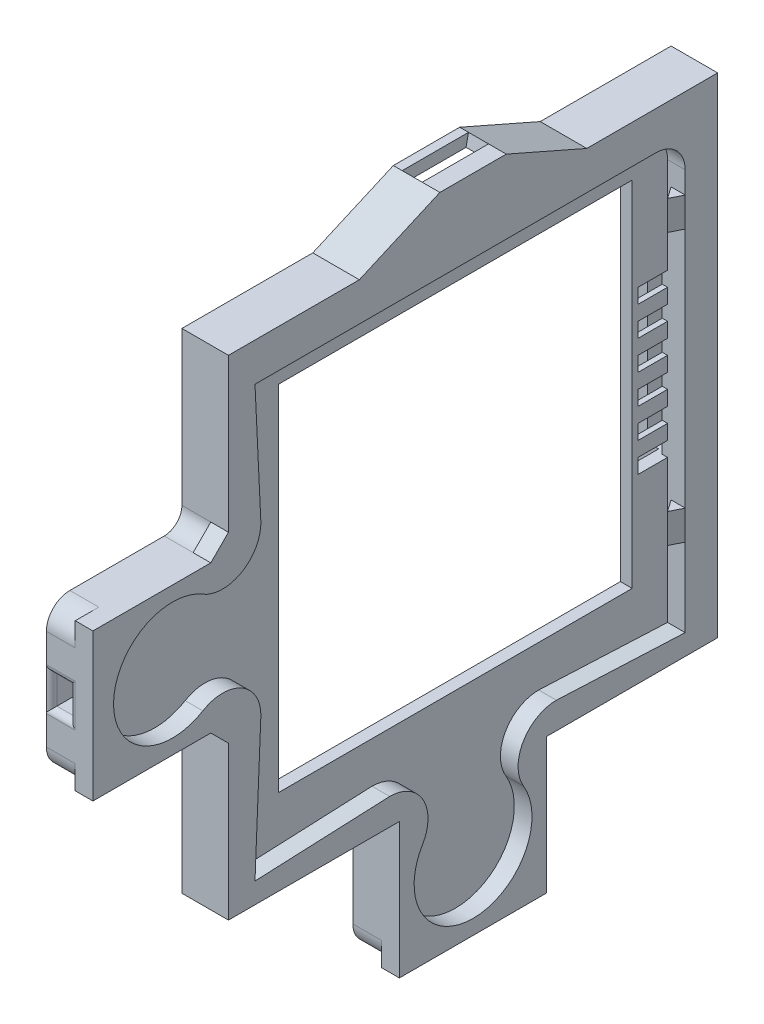
from build123d import *

# Parameters (mm, degrees)
SKETCH1_W                 = 190
SKETCH1_H                 = 190
BOSS_EXTRUDE1_DEPTH       = 10
CUT_EXTRUDE1_DEPTH        = 5
SKETCH3_W                 = 60
SKETCH3_H                 = 60
CUT_EXTRUDE2_DEPTH        = 139.021737418
CUT_EXTRUDE3_DEPTH        = 3
SKETCH8_W                 = 40.8
SKETCH8_H                 = 8.6
CUT_EXTRUDE4_DEPTH        = 2.6
CUT_EXTRUDE5_DEPTH        = 7
FILLET1_R                 = 3
SKETCH10_W                = 3.1
SKETCH10_H                = 5.2
CUT_EXTRUDE6_DEPTH        = 12.5
FILLET2_R                 = 1
SKETCH11_W                = 3.1
SKETCH11_H                = 5.2
CUT_EXTRUDE7_DEPTH        = 13.5
FILLET3_R                 = 1
FILLET4_R                 = 4
SKETCH12_W                = 4
SKETCH12_H                = 5.2
CUT_EXTRUDE8_DEPTH        = 2
SKETCH13_W                = 3
SKETCH13_H                = 5.2
CUT_EXTRUDE9_DEPTH        = 6
SKETCH14_W                = 3
SKETCH14_H                = 10
BOSS_EXTRUDE2_DEPTH       = 7
SKETCH16_W                = 3.2
SKETCH16_H                = 5
CUT_EXTRUDE10_DEPTH       = 6
FILLET5_R                 = 1
SKETCH17_W                = 131.159114754
SKETCH17_H                = 131.95401848
CUT_EXTRUDE11_DEPTH       = 2.1
CUT_EXTRUDE12_DEPTH       = 2
SKETCH19_W                = 5
SKETCH19_H                = 2.5
CUT_EXTRUDE13_DEPTH       = 139.108652879
SKETCH20_W                = 10.5
SKETCH20_H                = 27.5
CUT_EXTRUDE14_DEPTH       = 4
CHAMFER1_SIZE             = 0.9
BOSS_EXTRUDE10_DEPTH      = 1
BOSS_EXTRUDE10_DEPTH_BACK = 1
SKETCH33_W                = 5
SKETCH33_H                = 37.5
SKETCH34_W                = 3
SKETCH34_H                = 34
CUT_EXTRUDE19_DEPTH       = 3
CHAMFER2_SIZE             = 1
SKETCH24_R                = 5
SKETCH24_R_2              = 0.75
BOSS_EXTRUDE5_DEPTH       = 5
SKETCH25_R                = 0.75
CUT_EXTRUDE16_DEPTH       = 3.5
BOSS_EXTRUDE6_DEPTH       = 8
CUT_EXTRUDE17_REACH       = 140.163
SKETCH28_W                = 16
SKETCH28_H                = 5
SKETCH30_W                = 4
SKETCH30_H                = 10.417424305
SKETCH30_W_2              = 10.417424305
SKETCH30_H_2              = 4
BOSS_EXTRUDE8_DEPTH       = 2.5
FILLET10_START            = 2
FILLET10_DEPTH            = 5
FILLET10_START_2          = 4.5
FILLET10_2_DEPTH          = 3.5
FILLET10_START_3          = 2.1
FILLET10_3_DEPTH          = 2.4
FILLET10_4_DEPTH          = 0.4719
SKETCH31_R                = 0.75
CUT_EXTRUDE18_DEPTH       = 5
FILLET11_R                = 3
BOSS_EXTRUDE9_DEPTH       = 1.5
FILLET12_R                = 1.5
SKETCH35_R                = 2.5
CUT_EXTRUDE20_DEPTH       = 1.6
SKETCH36_W                = 3.2
SKETCH36_H                = 7
SKETCH36_W_2              = 7
SKETCH36_H_2              = 3.2
CUT_EXTRUDE21_DEPTH       = 139.113757461
BOSS_EXTRUDE12_START      = 8.7
BOSS_EXTRUDE12_DEPTH      = 5
BOSS_EXTRUDE13_START      = 54.7
BOSS_EXTRUDE13_DEPTH      = 5
CUT_EXTRUDE22_DEPTH       = 139.108652879
CUT_EXTRUDE22_DEPTH_BACK  = 139.108652879
SKETCH44_W                = 210.749266663
SKETCH44_H                = 205.670046908


with BuildPart() as part:
    # Sketch1 → Boss-Extrude1 (new body)
    with BuildSketch(Plane(origin=(0, 0, 0), x_dir=(0, 0, -1), z_dir=(1, 0, 0))):
        with Locations((-5, 0)):
            Rectangle(SKETCH1_W, SKETCH1_H)
    extrude(amount=BOSS_EXTRUDE1_DEPTH)

    # Sketch2 → Cut-Extrude1 (cut)
    with BuildSketch(Plane.ZY):
        Polygon((36.5, -36.5), (36.5, 36.5), (25.709845909, 36.5), (5.209845909, 45.5), (-5.209845909, 45.5), (-25.709845909, 36.5), (-36.5, 36.5), (-36.5, -36.5), align=None)
    extrude(amount=-CUT_EXTRUDE1_DEPTH, mode=Mode.SUBTRACT)

    # Sketch3 → Cut-Extrude2 (cut, through all)
    with BuildSketch(Plane.ZY.offset(-5)):
        Rectangle(SKETCH3_W, SKETCH3_H)
    extrude(amount=-CUT_EXTRUDE2_DEPTH, mode=Mode.SUBTRACT)

    # Sketch4 → Cut-Extrude3 (cut)
    with BuildSketch(Plane(origin=(10, 0, 0), x_dir=(0, 0, -1), z_dir=(1, 0, 0))):
        with BuildLine():
            Line((36, 30), (36, -37))
            Line((36, -37), (36, -38))
            Line((36, -38), (14.142135624, -37))
            ThreePointArc((14.142135624, -37), (8.484611805, -40.299621235), (8.570991287, -46.848484848))
            ThreePointArc((8.570991287, -46.848484848), (0, -62), (-8.570991287, -46.848484848))
            ThreePointArc((-8.570991287, -46.848484848), (-8.484611805, -40.299621235), (-14.142135624, -37))
            Line((-14.142135624, -37), (-37, -38))
            Line((-37, -38), (-36, -14.142135624))
            ThreePointArc((-36, -14.142135624), (-39.299621235, -8.484611805), (-45.848484848, -8.570991287))
            ThreePointArc((-45.848484848, -8.570991287), (-61, 0), (-45.848484848, 8.570991287))
            ThreePointArc((-45.848484848, 8.570991287), (-39.299621235, 8.484611805), (-36, 14.142135624))
            Line((-36, 14.142135624), (-37, 35))
            Line((-37, 35), (-36, 35))
            Line((-36, 35), (31, 35))
            ThreePointArc((31, 35), (34.535533906, 33.535533906), (36, 30))
        make_face()
    extrude(amount=-CUT_EXTRUDE3_DEPTH, mode=Mode.SUBTRACT)

    # Sketch8 → Cut-Extrude4 (cut)
    with BuildSketch(Plane.ZY):
        with Locations((0, 90.7)):
            Rectangle(SKETCH8_W, SKETCH8_H)
    extrude(amount=-CUT_EXTRUDE4_DEPTH, mode=Mode.SUBTRACT)

    # Sketch9 → Cut-Extrude5 (cut)
    # profile 1 of 2: a face of its own
    with BuildSketch(Plane.ZY):
        Polygon((-25.4, 90), (-85, 90), (-85, -90), (95, -90), (95, 90), (25.4, 90), (25.4, 81.4), (-25.4, 81.4), align=None)
        Polygon((-41.5, -41.5), (-41.5, 41.5), (-19.296204392, 41.5), (-5.629537726, 47.5), (5.629537726, 47.5), (19.296204392, 41.5), (41.5, 41.5), (41.5, 12.5), (64.5, 12.5), (64.5, -12.5), (41.5, -12.5), (41.5, -41.5), (12.5, -41.5), (12.5, -64.5), (-12.5, -64.5), (-12.5, -41.5), align=None, mode=Mode.SUBTRACT)
    # profile 2 of 2: a face of its own
    with BuildSketch(Plane.ZY):
        Polygon((-5.629537726, 47.5), (5.629537726, 47.5), (5.209845909, 45.5), (-5.209845909, 45.5), align=None)
    extrude(amount=-CUT_EXTRUDE5_DEPTH, mode=Mode.SUBTRACT)

    # Fillet1
    fillet1_edges = [part.edges().sort_by_distance(p)[0] for p in [
        (10, 95, 5),
        (10, 0, 100),
        (5, 95, 100),
    ]]
    fillet(fillet1_edges, radius=FILLET1_R)

    # Sketch10 → Cut-Extrude6 (cut)
    with BuildSketch(Plane.XZ.offset(64.5)):
        with Locations((4.45, 0)):
            Rectangle(SKETCH10_W, SKETCH10_H)
    extrude(amount=-CUT_EXTRUDE6_DEPTH, mode=Mode.SUBTRACT)

    # Fillet2
    fillet2_edges = [part.edges().sort_by_distance(p)[0] for p in [
        (2.9, -64.5, 0),
        (4.45, -64.5, -2.6),
        (6, -64.5, 0),
        (4.45, -64.5, 2.6),
    ]]
    fillet(fillet2_edges, radius=FILLET2_R - 0.0001)  # a hair under: the kernel refuses the full size

    # Sketch11 → Cut-Extrude7 (cut)
    with BuildSketch(Plane.XY.offset(64.5)):
        with Locations((4.45, 0)):
            Rectangle(SKETCH11_W, SKETCH11_H)
    extrude(amount=-CUT_EXTRUDE7_DEPTH, mode=Mode.SUBTRACT)

    # Fillet3
    fillet3_edges = [part.edges().sort_by_distance(p)[0] for p in [
        (2.9, 0, 64.5),
        (4.45, -2.6, 64.5),
        (6, 0, 64.5),
        (4.45, 2.6, 64.5),
    ]]
    fillet(fillet3_edges, radius=FILLET3_R - 0.0001)  # a hair under: the kernel refuses the full size

    # Fillet4
    fillet4_edges = [part.edges().sort_by_distance(p)[0] for p in [
        (3.5, -64.5, -12.5),
        (3.5, -64.5, 12.5),
        (3.5, -12.5, 64.5),
        (3.5, 12.5, 64.5),
    ]]
    fillet(fillet4_edges, radius=FILLET4_R)

    # Sketch12 → Cut-Extrude8 (cut)
    with BuildSketch(Plane.ZY):
        with Locations((-87, -82.4)):
            Rectangle(SKETCH12_W, SKETCH12_H)
    extrude(amount=-CUT_EXTRUDE8_DEPTH, mode=Mode.SUBTRACT)

    # Sketch13 → Cut-Extrude9 (cut)
    with BuildSketch(Plane.ZY.offset(-2)):
        with Locations((-87.5, -82.4)):
            Rectangle(SKETCH13_W, SKETCH13_H)
    extrude(amount=-CUT_EXTRUDE9_DEPTH, mode=Mode.SUBTRACT)

    # Sketch14 → Boss-Extrude2 (add)
    with BuildSketch(Plane.ZY.offset(-7)):
        with Locations((93.5, -82.4)):
            Rectangle(SKETCH14_W, SKETCH14_H)
    extrude(amount=BOSS_EXTRUDE2_DEPTH)

    # Sketch16 → Cut-Extrude10 (cut)
    with BuildSketch(Plane(origin=(0, 0, 92), x_dir=(-1, 0, 0), z_dir=(0, 0, -1))):
        with Locations((-2.6, -82.4)):
            Rectangle(SKETCH16_W, SKETCH16_H)
    extrude(amount=-CUT_EXTRUDE10_DEPTH, mode=Mode.SUBTRACT)

    # Fillet5
    fillet5_edges = [part.edges().sort_by_distance(p)[0] for p in [
        (4.2, -82.4, 92),
        (2.6, -84.9, 92),
        (2.6, -79.9, 92),
    ]]
    fillet(fillet5_edges, radius=FILLET5_R)

    # Sketch17 → Cut-Extrude11 (cut)
    with BuildSketch(Plane.ZY):
        Rectangle(SKETCH17_W, SKETCH17_H)
    extrude(amount=-CUT_EXTRUDE11_DEPTH, mode=Mode.SUBTRACT)

    # Sketch18 → Cut-Extrude12 (cut)
    with BuildSketch(Plane.ZY):
        Polygon((-23.4, 92), (-87, 92), (-87, -79.8), (-85, -79.8), (-85, 90), (-25.4, 90), (-25.4, 81.4), (25.4, 81.4), (25.4, 90), (95, 90), (95, -77.4), (97, -77.4), (97, 92), (23.4, 92), (23.4, 83.4), (-23.4, 83.4), align=None)
        Polygon((-85, -79.8), (-87, -79.8), (-87, -85), (-85, -85), (-85, -90), (95, -90), (95, -87.4), (92, -87.4), (92, -77.4), (95, -77.4), (95, 90), (25.4, 90), (25.4, 81.4), (-25.4, 81.4), (-25.4, 90), (-85, 90), align=None)
        Polygon((-85, -85), (-87, -85), (-87, -92), (97, -92), (97, -87.4), (95, -87.4), (95, -90), (-85, -90), align=None)
    extrude(amount=-CUT_EXTRUDE12_DEPTH, mode=Mode.SUBTRACT)

    # Sketch19 → Cut-Extrude13 (cut, through all)
    with BuildSketch(Plane(origin=(7, 0, 0), x_dir=(0, 0, -1), z_dir=(1, 0, 0))):
        with Locations((33.5, -12.5)):
            Rectangle(SKETCH19_W, SKETCH19_H)
        with Locations((33.5, -7.5)):
            Rectangle(SKETCH19_W, SKETCH19_H)
        with Locations((33.5, -2.5)):
            Rectangle(SKETCH19_W, SKETCH19_H)
        with Locations((33.5, 2.5)):
            Rectangle(SKETCH19_W, SKETCH19_H)
        with Locations((33.5, 7.5)):
            Rectangle(SKETCH19_W, SKETCH19_H)
        with Locations((33.5, 12.5)):
            Rectangle(SKETCH19_W, SKETCH19_H)
    extrude(amount=-CUT_EXTRUDE13_DEPTH, mode=Mode.SUBTRACT)

    # Sketch20 → Cut-Extrude14 (cut)
    with BuildSketch(Plane.ZY.offset(-2.1)):
        with Locations((-36.25, 0)):
            Rectangle(SKETCH20_W, SKETCH20_H)
    extrude(amount=-CUT_EXTRUDE14_DEPTH, mode=Mode.SUBTRACT)

    # Chamfer1
    chamfer1_edges = [part.edges().sort_by_distance(p)[0] for p in [
        (5, 0, -31),
    ]]
    chamfer(chamfer1_edges, length=CHAMFER1_SIZE)

    # Sketch33 → Boss-Extrude10 (add, two sides: drawn at the far end of the back side and taken through both)
    with BuildSketch(Plane.ZY.offset(-2.1).offset(-BOSS_EXTRUDE10_DEPTH_BACK)):
        with Locations((-39, 0)):
            Rectangle(SKETCH33_W, SKETCH33_H)
    extrude(amount=BOSS_EXTRUDE10_DEPTH + BOSS_EXTRUDE10_DEPTH_BACK)

    # Sketch34 → Cut-Extrude19 (cut)
    with BuildSketch(Plane(origin=(0, 0, -41.5), x_dir=(-1, 0, 0), z_dir=(0, 0, -1))):
        with Locations((-4.6, 0)):
            Rectangle(SKETCH34_W, SKETCH34_H)
    extrude(amount=-CUT_EXTRUDE19_DEPTH, mode=Mode.SUBTRACT)

    # Chamfer2
    # the kernel refuses this chamfer: 1 mm, written as the material it takes off along each edge
    with BuildSketch(Plane(origin=(6.1, 17, -41.5), x_dir=(1, 0, 0), z_dir=(0, -1, 0))) as chamfer2_piece_1_section:
        Polygon((CHAMFER2_SIZE, 0), (0, CHAMFER2_SIZE), (0, 0), align=None)
    chamfer2_piece_1 = extrude(amount=34, mode=Mode.PRIVATE)
    chamfer2_piece_1 = split(chamfer2_piece_1, bisect_by=Plane(origin=(7, 17, -41.5), z_dir=(-1, 0, 0)), keep=Keep.TOP, mode=Mode.PRIVATE)
    add(chamfer2_piece_1, mode=Mode.SUBTRACT)
    with BuildSketch(Plane(origin=(3.1, -17, -41.5), x_dir=(-1, 0, 0), z_dir=(0, 1, 0))) as chamfer2_piece_2:
        Polygon((CHAMFER2_SIZE, 0), (0, CHAMFER2_SIZE), (0, 0), align=None)
    extrude(amount=34, mode=Mode.SUBTRACT)
    with BuildSketch(Plane(origin=(6.1, 17, -41.5), x_dir=(0, 1, 0), z_dir=(-1, 0, 0)), Plane(origin=(3.1, -17, -41.5), x_dir=(0, -1, 0), z_dir=(1, 0, 0))) as chamfer2_piece_3:
        Polygon((CHAMFER2_SIZE, 0), (0, -CHAMFER2_SIZE), (0, 0), align=None)
    extrude(amount=3, mode=Mode.SUBTRACT)
    with BuildSketch(Plane(origin=(8.671682988, 17, -41.5), x_dir=(0, 1, 0), z_dir=(-1, 0, 0))) as chamfer2_piece_4a_section:
        Polygon((CHAMFER2_SIZE, 0), (0, -CHAMFER2_SIZE), (0, 0), align=None)
    chamfer2_piece_4a = extrude(amount=5.571682988, mode=Mode.PRIVATE)
    chamfer2_piece_4a = split(chamfer2_piece_4a, bisect_by=Plane(origin=(7, 17, -41.5), z_dir=(-1, 0, 0)), keep=Keep.TOP, mode=Mode.PRIVATE)
    chamfer2_piece_4a = split(chamfer2_piece_4a, bisect_by=Plane(origin=(6.1, 17, -41.5), z_dir=(1, 0, 0)), keep=Keep.TOP, mode=Mode.PRIVATE)
    with BuildSketch(Plane(origin=(6.1, 19.571682988, -41.5), x_dir=(1, 0, 0), z_dir=(0, -1, 0))) as chamfer2_piece_4b_section:
        Polygon((CHAMFER2_SIZE, 0), (0, CHAMFER2_SIZE), (0, 0), align=None)
    chamfer2_piece_4b = extrude(amount=36.571682988, mode=Mode.PRIVATE)
    chamfer2_piece_4b = split(chamfer2_piece_4b, bisect_by=Plane(origin=(7, 19.571682988, -41.5), z_dir=(-1, 0, 0)), keep=Keep.TOP, mode=Mode.PRIVATE)
    chamfer2_piece_4b = split(chamfer2_piece_4b, bisect_by=Plane(origin=(6.1, 17, -41.5), z_dir=(0, 1, 0)), keep=Keep.TOP, mode=Mode.PRIVATE)
    chamfer2_piece_4 = chamfer2_piece_4a & chamfer2_piece_4b
    add(chamfer2_piece_4, mode=Mode.SUBTRACT)
    with BuildSketch(Plane(origin=(6.1, 17, -41.5), x_dir=(1, 0, 0), z_dir=(0, -1, 0))) as chamfer2_piece_5a_section:
        Polygon((CHAMFER2_SIZE, 0), (0, CHAMFER2_SIZE), (0, 0), align=None)
    chamfer2_piece_5a = extrude(amount=36.571682988, mode=Mode.PRIVATE)
    chamfer2_piece_5a = split(chamfer2_piece_5a, bisect_by=Plane(origin=(7, 17, -41.5), z_dir=(-1, 0, 0)), keep=Keep.TOP, mode=Mode.PRIVATE)
    chamfer2_piece_5a = split(chamfer2_piece_5a, bisect_by=Plane(origin=(6.1, -17, -41.5), z_dir=(0, -1, 0)), keep=Keep.TOP, mode=Mode.PRIVATE)
    with BuildSketch(Plane(origin=(3.1, -17, -41.5), x_dir=(0, -1, 0), z_dir=(1, 0, 0))) as chamfer2_piece_5b_section:
        Polygon((CHAMFER2_SIZE, 0), (0, -CHAMFER2_SIZE), (0, 0), align=None)
    chamfer2_piece_5b = extrude(amount=5.571682988, mode=Mode.PRIVATE)
    chamfer2_piece_5b = split(chamfer2_piece_5b, bisect_by=Plane(origin=(7, -17, -41.5), z_dir=(-1, 0, 0)), keep=Keep.TOP, mode=Mode.PRIVATE)
    chamfer2_piece_5b = split(chamfer2_piece_5b, bisect_by=Plane(origin=(6.1, -17, -41.5), z_dir=(1, 0, 0)), keep=Keep.TOP, mode=Mode.PRIVATE)
    chamfer2_piece_5 = chamfer2_piece_5a & chamfer2_piece_5b
    add(chamfer2_piece_5, mode=Mode.SUBTRACT)
    with BuildSketch(Plane(origin=(3.1, -19.571682988, -41.5), x_dir=(-1, 0, 0), z_dir=(0, 1, 0))) as chamfer2_piece_6a_section:
        Polygon((CHAMFER2_SIZE, 0), (0, CHAMFER2_SIZE), (0, 0), align=None)
    chamfer2_piece_6a = extrude(amount=36.571682988, mode=Mode.PRIVATE)
    chamfer2_piece_6a = split(chamfer2_piece_6a, bisect_by=Plane(origin=(3.1, -17, -41.5), z_dir=(0, -1, 0)), keep=Keep.TOP, mode=Mode.PRIVATE)
    with BuildSketch(Plane(origin=(0.528317012, -17, -41.5), x_dir=(0, -1, 0), z_dir=(1, 0, 0))) as chamfer2_piece_6b_section:
        Polygon((CHAMFER2_SIZE, 0), (0, -CHAMFER2_SIZE), (0, 0), align=None)
    chamfer2_piece_6b = extrude(amount=5.571682988, mode=Mode.PRIVATE)
    chamfer2_piece_6b = split(chamfer2_piece_6b, bisect_by=Plane(origin=(3.1, -17, -41.5), z_dir=(-1, 0, 0)), keep=Keep.TOP, mode=Mode.PRIVATE)
    chamfer2_piece_6 = chamfer2_piece_6a & chamfer2_piece_6b
    add(chamfer2_piece_6, mode=Mode.SUBTRACT)
    with BuildSketch(Plane(origin=(3.1, -17, -41.5), x_dir=(-1, 0, 0), z_dir=(0, 1, 0))) as chamfer2_piece_7a_section:
        Polygon((CHAMFER2_SIZE, 0), (0, CHAMFER2_SIZE), (0, 0), align=None)
    chamfer2_piece_7a = extrude(amount=36.571682988, mode=Mode.PRIVATE)
    chamfer2_piece_7a = split(chamfer2_piece_7a, bisect_by=Plane(origin=(3.1, 17, -41.5), z_dir=(0, 1, 0)), keep=Keep.TOP, mode=Mode.PRIVATE)
    with BuildSketch(Plane(origin=(6.1, 17, -41.5), x_dir=(0, 1, 0), z_dir=(-1, 0, 0))) as chamfer2_piece_7b_section:
        Polygon((CHAMFER2_SIZE, 0), (0, -CHAMFER2_SIZE), (0, 0), align=None)
    chamfer2_piece_7b = extrude(amount=5.571682988, mode=Mode.PRIVATE)
    chamfer2_piece_7b = split(chamfer2_piece_7b, bisect_by=Plane(origin=(3.1, 17, -41.5), z_dir=(-1, 0, 0)), keep=Keep.TOP, mode=Mode.PRIVATE)
    chamfer2_piece_7 = chamfer2_piece_7a & chamfer2_piece_7b
    add(chamfer2_piece_7, mode=Mode.SUBTRACT)

    # Sketch24 → Boss-Extrude5 (add)
    # profile 1 of 2: a face of its own
    with BuildSketch(Plane.ZY.offset(-7)):
        with Locations((80, -75)):
            Circle(SKETCH24_R)
        with Locations((80, -75)):
            Circle(SKETCH24_R_2, mode=Mode.SUBTRACT)
    # profile 2 of 2: a face of its own
    with BuildSketch(Plane.ZY.offset(-7)):
        with Locations((-70, -75)):
            Circle(SKETCH24_R)
        with Locations((-70, -75)):
            Circle(SKETCH24_R_2, mode=Mode.SUBTRACT)
    boss_extrude5 = extrude(amount=BOSS_EXTRUDE5_DEPTH)

    # Mirror1: Boss-Extrude5 across plane
    add(boss_extrude5.mirror(Plane.ZX))

    # Sketch25 → Cut-Extrude16 (cut)
    with BuildSketch(Plane.ZY.offset(-2.1)):
        with Locations((-38.5, 38.5)):
            Circle(SKETCH25_R)
        with Locations((38.5, 38.5)):
            Circle(SKETCH25_R)
        with Locations((38.5, -38.5)):
            Circle(SKETCH25_R)
        with Locations((-38.5, -38.5)):
            Circle(SKETCH25_R)
    extrude(amount=-CUT_EXTRUDE16_DEPTH, mode=Mode.SUBTRACT)

    # Sketch27 → Boss-Extrude6 (add)
    with BuildSketch(Plane.XZ.offset(-90)):
        Polygon((7, -45.5), (7, -41.5), (2, -41.5), (2, -65.5), (7, -65.5), (7, -61.5), (4.5, -61.5), (4.5, -45.5), align=None)
    extrude(amount=BOSS_EXTRUDE6_DEPTH)

    # Sketch28 → Cut-Extrude17 (cut, up to next)
    with BuildSketch(Plane.ZY.offset(-2), mode=Mode.PRIVATE) as cut_extrude17_sk1:
        with Locations((-53.5, 87.5)):
            Rectangle(SKETCH28_W, SKETCH28_H)
    cut_extrude17_tool1 = extrude(cut_extrude17_sk1.sketch, amount=-CUT_EXTRUDE17_REACH, mode=Mode.PRIVATE) & part.part
    add(cut_extrude17_tool1.solids().sort_by_distance((2, 87.5, -53.5))[0], mode=Mode.SUBTRACT)

    # Sketch30 → Boss-Extrude8 (add)
    with BuildSketch(Plane.ZY.offset(-7)):
        with Locations((-70, -84.791287848)):
            Rectangle(SKETCH30_W, SKETCH30_H)
        with Locations((89.791287848, 75)):
            Rectangle(SKETCH30_W_2, SKETCH30_H_2)
        with Locations((80, 84.791287848)):
            Rectangle(SKETCH30_W, SKETCH30_H)
        with Locations((-79.791287848, 75)):
            Rectangle(SKETCH30_W_2, SKETCH30_H_2)
        Polygon((37.5, 41.5), (41.5, 41.5), (41.5, 73), (75.417424305, 73), (75.417424305, 77), (41.5, 77), (41.5, 90), (37.5, 90), align=None)
        Polygon((41.5, -37.5), (41.5, -41.5), (78, -41.5), (78, -70.417424305), (82, -70.417424305), (82, -41.5), (95, -41.5), (95, -37.5), (82, -37.5), (82, 37.5), (95, 37.5), (95, 41.5), (82, 41.5), (82, 70.417424305), (78, 70.417424305), (78, 41.5), (41.5, 41.5), (41.5, 37.5), (78, 37.5), (78, -37.5), align=None)
        Polygon((-37.5, -41.5), (-41.5, -41.5), (-41.5, -73), (-65.417424305, -73), (-65.417424305, -77), (-41.5, -77), (-41.5, -90), (-37.5, -90), (-37.5, -77), (37.5, -77), (37.5, -92), (41.5, -92), (41.5, -77), (75.417424305, -77), (75.417424305, -73), (41.5, -73), (41.5, -41.5), (37.5, -41.5), (37.5, -73), (-37.5, -73), align=None)
        Polygon((-68, 70.417424305), (-72, 70.417424305), (-72, 41.5), (-85, 41.5), (-85, 37.5), (-72, 37.5), (-72, -37.5), (-85, -37.5), (-85, -41.5), (-72, -41.5), (-72, -70.417424305), (-68, -70.417424305), (-68, -41.5), (-41.5, -41.5), (-41.5, -37.5), (-68, -37.5), align=None)
        with Locations((-79.791287848, -75)):
            Rectangle(SKETCH30_W_2, SKETCH30_H_2)
        with Locations((-70, 84.791287848)):
            Rectangle(SKETCH30_W, SKETCH30_H)
        with Locations((89.791287848, -75)):
            Rectangle(SKETCH30_W_2, SKETCH30_H_2)
    extrude(amount=BOSS_EXTRUDE8_DEPTH)

    # Fillet10: read off the stored shape, not the designer's step
    # Fillet10 outline → Fillet10 (cut)
    with BuildSketch(Plane.YZ.offset(FILLET10_START)):
        with BuildLine():
            Line((82, -65.5), (85, -65.5))
            ThreePointArc((85, -65.5), (82.878679656, -64.621320344), (82, -62.5))
            Line((82, -62.5), (82, -65.5))
        make_face()
        with BuildLine():
            Line((82, -41.5), (82, -44.5))
            ThreePointArc((82, -44.5), (82.878679656, -42.378679656), (85, -41.5))
            Line((85, -41.5), (82, -41.5))
        make_face()
        with BuildLine():
            Line((81.4, -25.4), (84.4, -25.4))
            ThreePointArc((84.4, -25.4), (82.278679656, -24.521320344), (81.4, -22.4))
            Line((81.4, -22.4), (81.4, -25.4))
        make_face()
        with BuildLine():
            ThreePointArc((81.4, 22.4), (82.278679656, 24.521320344), (84.4, 25.4))
            Line((84.4, 25.4), (81.4, 25.4))
            Line((81.4, 25.4), (81.4, 22.4))
        make_face()
    extrude(amount=FILLET10_DEPTH, mode=Mode.SUBTRACT)

    # Fillet10 2 outline → Fillet10 2 (add)
    with BuildSketch(Plane.YZ.offset(FILLET10_START_2)):
        with BuildLine():
            Line((-73, -37.5), (-70, -37.5))
            ThreePointArc((-70, -37.5), (-72.121320344, -36.621320344), (-73, -34.5))
            Line((-73, -34.5), (-73, -37.5))
        make_face()
        with BuildLine():
            Line((12.5, 41.5), (15.5, 41.5))
            ThreePointArc((15.5, 41.5), (13.378679656, 42.378679656), (12.5, 44.5))
            Line((12.5, 44.5), (12.5, 41.5))
        make_face()
        with BuildLine():
            ThreePointArc((-12.5, 44.5), (-13.378679656, 42.378679656), (-15.5, 41.5))
            Line((-15.5, 41.5), (-12.5, 41.5))
            Line((-12.5, 41.5), (-12.5, 44.5))
        make_face()
        with BuildLine():
            ThreePointArc((-41.5, -34.5), (-42.378679656, -36.621320344), (-44.5, -37.5))
            Line((-44.5, -37.5), (-41.5, -37.5))
            Line((-41.5, -37.5), (-41.5, -34.5))
        make_face()
        with BuildLine():
            Line((-73, 37.5), (-73, 34.5))
            ThreePointArc((-73, 34.5), (-72.121320344, 36.621320344), (-70, 37.5))
            Line((-70, 37.5), (-73, 37.5))
        make_face()
        with BuildLine():
            Line((-41.5, -44.5), (-41.5, -41.5))
            Line((-41.5, -41.5), (-44.5, -41.5))
            ThreePointArc((-44.5, -41.5), (-42.378679656, -42.378679656), (-41.5, -44.5))
        make_face()
        with BuildLine():
            Line((-41.5, 37.5), (-44.5, 37.5))
            ThreePointArc((-44.5, 37.5), (-42.378679656, 36.621320344), (-41.5, 34.5))
            Line((-41.5, 34.5), (-41.5, 37.5))
        make_face()
        with BuildLine():
            Line((-34.5, -41.5), (-37.5, -41.5))
            Line((-37.5, -41.5), (-37.5, -44.5))
            ThreePointArc((-37.5, -44.5), (-36.621320344, -42.378679656), (-34.5, -41.5))
        make_face()
        with BuildLine():
            Line((-41.5, -68), (-41.5, -65))
            ThreePointArc((-41.5, -65), (-42.378679656, -67.121320344), (-44.5, -68))
            Line((-44.5, -68), (-41.5, -68))
        make_face()
        with BuildLine():
            ThreePointArc((-73, -44.5), (-72.121320344, -42.378679656), (-70, -41.5))
            Line((-70, -41.5), (-73, -41.5))
            Line((-73, -41.5), (-73, -44.5))
        make_face()
        with BuildLine():
            Line((-44.5, 41.5), (-41.5, 41.5))
            Line((-41.5, 41.5), (-41.5, 44.5))
            ThreePointArc((-41.5, 44.5), (-42.378679656, 42.378679656), (-44.5, 41.5))
        make_face()
        with BuildLine():
            ThreePointArc((-34.5, -68), (-36.621320344, -67.121320344), (-37.5, -65))
            Line((-37.5, -65), (-37.5, -68))
            Line((-37.5, -68), (-34.5, -68))
        make_face()
        with BuildLine():
            Line((-37.5, 44.5), (-37.5, 41.5))
            Line((-37.5, 41.5), (-34.5, 41.5))
            ThreePointArc((-34.5, 41.5), (-36.621320344, 42.378679656), (-37.5, 44.5))
        make_face()
        with BuildLine():
            Line((-70.417424305, -68), (-68.755002002, -68))
            ThreePointArc((-68.755002002, -68), (-70.054040108, -67.704163457), (-71.096876251, -66.875))
            ThreePointArc((-71.096876251, -66.875), (-70.720025699, -67.41507834), (-70.417424305, -68))
        make_face()
        with BuildLine():
            ThreePointArc((-71.875, -66.096876251), (-72.704163457, -65.054040108), (-73, -63.755002002))
            Line((-73, -63.755002002), (-73, -65.417424305))
            ThreePointArc((-73, -65.417424305), (-72.41507834, -65.720025699), (-71.875, -66.096876251))
        make_face()
        with BuildLine():
            ThreePointArc((-44.5, 78), (-42.378679656, 77.121320344), (-41.5, 75))
            Line((-41.5, 75), (-41.5, 78))
            Line((-41.5, 78), (-44.5, 78))
        make_face()
        with BuildLine():
            Line((-73, 41.5), (-70, 41.5))
            ThreePointArc((-70, 41.5), (-72.121320344, 42.378679656), (-73, 44.5))
            Line((-73, 44.5), (-73, 41.5))
        make_face()
        with BuildLine():
            ThreePointArc((71.096876251, -66.875), (70.054040108, -67.704163457), (68.755002002, -68))
            Line((68.755002002, -68), (70.417424305, -68))
            ThreePointArc((70.417424305, -68), (70.720025699, -67.41507834), (71.096876251, -66.875))
        make_face()
        with BuildLine():
            Line((-37.5, 78), (-37.5, 75))
            ThreePointArc((-37.5, 75), (-36.621320344, 77.121320344), (-34.5, 78))
            Line((-34.5, 78), (-37.5, 78))
        make_face()
        with BuildLine():
            ThreePointArc((-78.125, -66.096876251), (-77.58492166, -65.720025699), (-77, -65.417424305))
            Line((-77, -65.417424305), (-77, -63.755002002))
            ThreePointArc((-77, -63.755002002), (-77.295836543, -65.054040108), (-78.125, -66.096876251))
        make_face()
        with BuildLine():
            ThreePointArc((-71.096876251, 76.875), (-70.054040108, 77.704163457), (-68.755002002, 78))
            Line((-68.755002002, 78), (-70.417424305, 78))
            ThreePointArc((-70.417424305, 78), (-70.720025699, 77.41507834), (-71.096876251, 76.875))
        make_face()
        with BuildLine():
            Line((-73, 75.417424305), (-73, 73.755002002))
            ThreePointArc((-73, 73.755002002), (-72.704163457, 75.054040108), (-71.875, 76.096876251))
            ThreePointArc((-71.875, 76.096876251), (-72.41507834, 75.720025699), (-73, 75.417424305))
        make_face()
        with BuildLine():
            Line((-68.755002002, -72), (-70.417424305, -72))
            ThreePointArc((-70.417424305, -72), (-70.720025699, -72.58492166), (-71.096876251, -73.125))
            ThreePointArc((-71.096876251, -73.125), (-70.054040108, -72.295836543), (-68.755002002, -72))
        make_face()
        with BuildLine():
            ThreePointArc((71.096876251, -73.125), (70.720025699, -72.58492166), (70.417424305, -72))
            Line((70.417424305, -72), (68.755002002, -72))
            ThreePointArc((68.755002002, -72), (70.054040108, -72.295836543), (71.096876251, -73.125))
        make_face()
        with BuildLine():
            Line((37.5, 78), (34.5, 78))
            ThreePointArc((34.5, 78), (36.621320344, 77.121320344), (37.5, 75))
            Line((37.5, 75), (37.5, 78))
        make_face()
        with BuildLine():
            ThreePointArc((90, -65.5), (88.978451781, -67.291287848), (87.041960108, -68))
            Line((87.041960108, -68), (90, -68))
            Line((90, -68), (90, -65.5))
        make_face()
        with BuildLine():
            ThreePointArc((-79.582575695, -68), (-79.279974301, -67.41507834), (-78.903123749, -66.875))
            ThreePointArc((-78.903123749, -66.875), (-79.945959892, -67.704163457), (-81.244997998, -68))
            Line((-81.244997998, -68), (-79.582575695, -68))
        make_face()
        with BuildLine():
            ThreePointArc((-80, -41.5), (-77.878679656, -42.378679656), (-77, -44.5))
            Line((-77, -44.5), (-77, -41.5))
            Line((-77, -41.5), (-80, -41.5))
        make_face()
        with BuildLine():
            Line((-77, 73.755002002), (-77, 75.417424305))
            ThreePointArc((-77, 75.417424305), (-77.58492166, 75.720025699), (-78.125, 76.096876251))
            ThreePointArc((-78.125, 76.096876251), (-77.295836543, 75.054040108), (-77, 73.755002002))
        make_face()
        with BuildLine():
            ThreePointArc((-73, -76.244997998), (-72.704163457, -74.945959892), (-71.875, -73.903123749))
            ThreePointArc((-71.875, -73.903123749), (-72.41507834, -74.279974301), (-73, -74.582575695))
            Line((-73, -74.582575695), (-73, -76.244997998))
        make_face()
        with BuildLine():
            Line((-41.5, -72), (-44.5, -72))
            ThreePointArc((-44.5, -72), (-42.378679656, -72.878679656), (-41.5, -75))
            Line((-41.5, -75), (-41.5, -72))
        make_face()
        with BuildLine():
            ThreePointArc((41.5, -75), (42.378679656, -72.878679656), (44.5, -72))
            Line((44.5, -72), (41.5, -72))
            Line((41.5, -72), (41.5, -75))
        make_face()
        with BuildLine():
            ThreePointArc((73, -74.582575695), (72.41507834, -74.279974301), (71.875, -73.903123749))
            ThreePointArc((71.875, -73.903123749), (72.704163457, -74.945959892), (73, -76.244997998))
            Line((73, -76.244997998), (73, -74.582575695))
        make_face()
        with BuildLine():
            Line((37.5, 41.5), (37.5, 44.5))
            ThreePointArc((37.5, 44.5), (36.621320344, 42.378679656), (34.5, 41.5))
            Line((34.5, 41.5), (37.5, 41.5))
        make_face()
        with BuildLine():
            ThreePointArc((-71.096876251, 83.125), (-70.720025699, 82.58492166), (-70.417424305, 82))
            Line((-70.417424305, 82), (-68.755002002, 82))
            ThreePointArc((-68.755002002, 82), (-70.054040108, 82.295836543), (-71.096876251, 83.125))
        make_face()
        with BuildLine():
            Line((90, -75), (90, -72))
            Line((90, -72), (87, -72))
            ThreePointArc((87, -72), (89.121320344, -72.878679656), (90, -75))
        make_face()
        with BuildLine():
            ThreePointArc((77, -76.244997998), (77.295836543, -74.945959892), (78.125, -73.903123749))
            ThreePointArc((78.125, -73.903123749), (77.58492166, -74.279974301), (77, -74.582575695))
            Line((77, -74.582575695), (77, -76.244997998))
        make_face()
        with BuildLine():
            ThreePointArc((-78.903123749, -73.125), (-79.279974301, -72.58492166), (-79.582575695, -72))
            Line((-79.582575695, -72), (-81.244997998, -72))
            ThreePointArc((-81.244997998, -72), (-79.945959892, -72.295836543), (-78.903123749, -73.125))
        make_face()
        with BuildLine():
            ThreePointArc((-90, -44.5), (-89.121320344, -42.378679656), (-87, -41.5))
            Line((-87, -41.5), (-90, -41.5))
            Line((-90, -41.5), (-90, -44.5))
        make_face()
        with BuildLine():
            Line((-77, 41.5), (-77, 44.5))
            ThreePointArc((-77, 44.5), (-77.878679656, 42.378679656), (-80, 41.5))
            Line((-80, 41.5), (-77, 41.5))
        make_face()
        with BuildLine():
            Line((-77, -76.244997998), (-77, -74.582575695))
            ThreePointArc((-77, -74.582575695), (-77.58492166, -74.279974301), (-78.125, -73.903123749))
            ThreePointArc((-78.125, -73.903123749), (-77.295836543, -74.945959892), (-77, -76.244997998))
        make_face()
        with BuildLine():
            Line((-41.5, -85), (-41.5, -82))
            ThreePointArc((-41.5, -82), (-42.378679656, -84.121320344), (-44.5, -85))
            Line((-44.5, -85), (-41.5, -85))
        make_face()
        with BuildLine():
            ThreePointArc((44.5, -85), (42.378679656, -84.121320344), (41.5, -82))
            Line((41.5, -82), (41.5, -85))
            Line((41.5, -85), (44.5, -85))
        make_face()
        with BuildLine():
            Line((73, -85), (73, -82))
            ThreePointArc((73, -82), (72.121320344, -84.121320344), (70, -85))
            Line((70, -85), (73, -85))
        make_face()
        with BuildLine():
            Line((41.5, 44.5), (41.5, 41.5))
            Line((41.5, 41.5), (44.5, 41.5))
            ThreePointArc((44.5, 41.5), (42.378679656, 42.378679656), (41.5, 44.5))
        make_face()
        with BuildLine():
            ThreePointArc((-41.5, 85), (-42.378679656, 82.878679656), (-44.5, 82))
            Line((-44.5, 82), (-41.5, 82))
            Line((-41.5, 82), (-41.5, 85))
        make_face()
        with BuildLine():
            ThreePointArc((-77.4, 92), (-77.29827535, 92.774596669), (-77, 93.496662955))
            Line((-77, 93.496662955), (-77, 95))
            Line((-77, 95), (-77.4, 95))
            Line((-77.4, 95), (-77.4, 92))
        make_face()
        with BuildLine():
            Line((90, -85), (90, -82))
            ThreePointArc((90, -82), (89.121320344, -84.121320344), (87, -85))
            Line((87, -85), (90, -85))
        make_face()
        with BuildLine():
            ThreePointArc((80, -85), (77.878679656, -84.121320344), (77, -82))
            Line((77, -82), (77, -85))
            Line((77, -85), (80, -85))
        make_face()
        with BuildLine():
            ThreePointArc((-87, -85), (-89.121320344, -84.121320344), (-90, -82))
            Line((-90, -82), (-90, -85))
            Line((-90, -85), (-87, -85))
        make_face()
        with BuildLine():
            Line((44.5, 37.5), (41.5, 37.5))
            Line((41.5, 37.5), (41.5, 34.5))
            ThreePointArc((41.5, 34.5), (42.378679656, 36.621320344), (44.5, 37.5))
        make_face()
        with BuildLine():
            Line((-90, 41.5), (-87, 41.5))
            ThreePointArc((-87, 41.5), (-89.121320344, 42.378679656), (-90, 44.5))
            Line((-90, 44.5), (-90, 41.5))
        make_face()
        with BuildLine():
            Line((-37.5, -82), (-37.5, -85))
            Line((-37.5, -85), (-34.5, -85))
            ThreePointArc((-34.5, -85), (-36.621320344, -84.121320344), (-37.5, -82))
        make_face()
        with BuildLine():
            Line((34.5, -85), (37.5, -85))
            Line((37.5, -85), (37.5, -82))
            ThreePointArc((37.5, -82), (36.621320344, -84.121320344), (34.5, -85))
        make_face()
        with BuildLine():
            ThreePointArc((-77, -34.5), (-77.878679656, -36.621320344), (-80, -37.5))
            Line((-80, -37.5), (-77, -37.5))
            Line((-77, -37.5), (-77, -34.5))
        make_face()
        with BuildLine():
            Line((-90, 37.5), (-90, 34.5))
            ThreePointArc((-90, 34.5), (-89.121320344, 36.621320344), (-87, 37.5))
            Line((-87, 37.5), (-90, 37.5))
        make_face()
        with BuildLine():
            Line((41.5, 78), (41.5, 75))
            ThreePointArc((41.5, 75), (42.378679656, 77.121320344), (44.5, 78))
            Line((44.5, 78), (41.5, 78))
        make_face()
        with BuildLine():
            ThreePointArc((73, 44.5), (72.121320344, 42.378679656), (70, 41.5))
            Line((70, 41.5), (73, 41.5))
            Line((73, 41.5), (73, 44.5))
        make_face()
        with BuildLine():
            Line((-41.5, 95), (-44.5, 95))
            ThreePointArc((-44.5, 95), (-42.378679656, 94.121320344), (-41.5, 92))
            Line((-41.5, 92), (-41.5, 95))
        make_face()
        with BuildLine():
            ThreePointArc((90, -38.5), (89.121320344, -40.621320344), (87, -41.5))
            Line((87, -41.5), (90, -41.5))
            Line((90, -41.5), (90, -38.5))
        make_face()
        with BuildLine():
            Line((90, 37.5), (87, 37.5))
            ThreePointArc((87, 37.5), (89.121320344, 36.621320344), (90, 34.5))
            Line((90, 34.5), (90, 37.5))
        make_face()
        with BuildLine():
            Line((-37.5, -72), (-37.5, -75))
            ThreePointArc((-37.5, -75), (-36.621320344, -72.878679656), (-34.5, -72))
            Line((-34.5, -72), (-37.5, -72))
        make_face()
        with BuildLine():
            ThreePointArc((34.5, -72), (36.621320344, -72.878679656), (37.5, -75))
            Line((37.5, -75), (37.5, -72))
            Line((37.5, -72), (34.5, -72))
        make_face()
        with BuildLine():
            ThreePointArc((-80, 37.5), (-77.878679656, 36.621320344), (-77, 34.5))
            Line((-77, 34.5), (-77, 37.5))
            Line((-77, 37.5), (-80, 37.5))
        make_face()
        with BuildLine():
            Line((70.417424305, 78), (68.755002002, 78))
            ThreePointArc((68.755002002, 78), (70.054040108, 77.704163457), (71.096876251, 76.875))
            ThreePointArc((71.096876251, 76.875), (70.720025699, 77.41507834), (70.417424305, 78))
        make_face()
        with BuildLine():
            ThreePointArc((71.875, 76.096876251), (72.704163457, 75.054040108), (73, 73.755002002))
            Line((73, 73.755002002), (73, 75.417424305))
            ThreePointArc((73, 75.417424305), (72.41507834, 75.720025699), (71.875, 76.096876251))
        make_face()
        with BuildLine():
            Line((-34.5, 95), (-37.5, 95))
            Line((-37.5, 95), (-37.5, 92))
            ThreePointArc((-37.5, 92), (-36.621320344, 94.121320344), (-34.5, 95))
        make_face()
        with BuildLine():
            ThreePointArc((87, -25.4), (89.121320344, -26.278679656), (90, -28.4))
            Line((90, -28.4), (90, -25.4))
            Line((90, -25.4), (87, -25.4))
        make_face()
        with BuildLine():
            Line((90, 25.4), (90, 28.4))
            ThreePointArc((90, 28.4), (89.121320344, 26.278679656), (87, 25.4))
            Line((87, 25.4), (90, 25.4))
        make_face()
        with BuildLine():
            Line((87, 41.5), (90, 41.5))
            Line((90, 41.5), (90, 44.5))
            ThreePointArc((90, 44.5), (89.121320344, 42.378679656), (87, 41.5))
        make_face()
        with BuildLine():
            Line((68.755002002, 82), (70.417424305, 82))
            ThreePointArc((70.417424305, 82), (70.720025699, 82.58492166), (71.096876251, 83.125))
            ThreePointArc((71.096876251, 83.125), (70.054040108, 82.295836543), (68.755002002, 82))
        make_face()
        with BuildLine():
            ThreePointArc((78.125, 76.096876251), (77.58492166, 75.720025699), (77, 75.417424305))
            Line((77, 75.417424305), (77, 73.755002002))
            ThreePointArc((77, 73.755002002), (77.295836543, 75.054040108), (78.125, 76.096876251))
        make_face()
        with BuildLine():
            Line((37.5, 95), (34.5, 95))
            ThreePointArc((34.5, 95), (36.621320344, 94.121320344), (37.5, 92))
            Line((37.5, 92), (37.5, 95))
        make_face()
        with BuildLine():
            ThreePointArc((-34.5, 82), (-36.621320344, 82.878679656), (-37.5, 85))
            Line((-37.5, 85), (-37.5, 82))
            Line((-37.5, 82), (-34.5, 82))
        make_face()
        with BuildLine():
            Line((77, 41.5), (80, 41.5))
            ThreePointArc((80, 41.5), (77.878679656, 42.378679656), (77, 44.5))
            Line((77, 44.5), (77, 41.5))
        make_face()
        with BuildLine():
            ThreePointArc((87, 78), (89.121320344, 77.121320344), (90, 75))
            Line((90, 75), (90, 78))
            Line((90, 78), (87, 78))
        make_face()
        with BuildLine():
            ThreePointArc((73, 86.244997998), (72.704163457, 84.945959892), (71.875, 83.903123749))
            ThreePointArc((71.875, 83.903123749), (72.41507834, 84.279974301), (73, 84.582575695))
            Line((73, 84.582575695), (73, 86.244997998))
        make_face()
        with BuildLine():
            Line((41.5, 82), (44.5, 82))
            ThreePointArc((44.5, 82), (42.378679656, 82.878679656), (41.5, 85))
            Line((41.5, 85), (41.5, 82))
        make_face()
        with BuildLine():
            ThreePointArc((79.582575695, 78), (79.279974301, 77.41507834), (78.903123749, 76.875))
            ThreePointArc((78.903123749, 76.875), (79.945959892, 77.704163457), (81.244997998, 78))
            Line((81.244997998, 78), (79.582575695, 78))
        make_face()
        with BuildLine():
            Line((37.5, 82), (37.5, 85))
            ThreePointArc((37.5, 85), (36.621320344, 82.878679656), (34.5, 82))
            Line((34.5, 82), (37.5, 82))
        make_face()
        with BuildLine():
            Line((44.5, 95), (41.5, 95))
            Line((41.5, 95), (41.5, 92))
            ThreePointArc((41.5, 92), (42.378679656, 94.121320344), (44.5, 95))
        make_face()
        with BuildLine():
            Line((87, 82), (90, 82))
            Line((90, 82), (90, 85))
            ThreePointArc((90, 85), (89.121320344, 82.878679656), (87, 82))
        make_face()
        with BuildLine():
            ThreePointArc((70, 95), (72.121320344, 94.121320344), (73, 92))
            Line((73, 92), (73, 95))
            Line((73, 95), (70, 95))
        make_face()
        with BuildLine():
            Line((77, 86.244997998), (77, 84.582575695))
            ThreePointArc((77, 84.582575695), (77.58492166, 84.279974301), (78.125, 83.903123749))
            ThreePointArc((78.125, 83.903123749), (77.295836543, 84.945959892), (77, 86.244997998))
        make_face()
        with BuildLine():
            Line((79.582575695, 82), (81.244997998, 82))
            ThreePointArc((81.244997998, 82), (79.945959892, 82.295836543), (78.903123749, 83.125))
            ThreePointArc((78.903123749, 83.125), (79.279974301, 82.58492166), (79.582575695, 82))
        make_face()
        with BuildLine():
            ThreePointArc((87, 95), (89.121320344, 94.121320344), (90, 92))
            Line((90, 92), (90, 95))
            Line((90, 95), (87, 95))
        make_face()
        with BuildLine():
            Line((80, 95), (77, 95))
            Line((77, 95), (77, 92))
            ThreePointArc((77, 92), (77.878679656, 94.121320344), (80, 95))
        make_face()
    extrude(amount=FILLET10_2_DEPTH)

    # Fillet10 3 outline → Fillet10 3 (add)
    with BuildSketch(Plane.YZ.offset(FILLET10_START_3)):
        with BuildLine():
            Line((12.5, 41.5), (15.5, 41.5))
            ThreePointArc((15.5, 41.5), (13.378679656, 42.378679656), (12.5, 44.5))
            Line((12.5, 44.5), (12.5, 41.5))
        make_face()
        with BuildLine():
            ThreePointArc((-12.5, 44.5), (-13.378679656, 42.378679656), (-15.5, 41.5))
            Line((-15.5, 41.5), (-12.5, 41.5))
            Line((-12.5, 41.5), (-12.5, 44.5))
        make_face()
        with BuildLine():
            Line((-74.4, 95), (-77.4, 95))
            Line((-77.4, 95), (-77.4, 92))
            ThreePointArc((-77.4, 92), (-76.521320344, 94.121320344), (-74.4, 95))
        make_face()
        with BuildLine():
            Line((90, -85), (90, -82))
            ThreePointArc((90, -82), (89.121320344, -84.121320344), (87, -85))
            Line((87, -85), (90, -85))
        make_face()
        with BuildLine():
            ThreePointArc((-87, -85), (-89.121320344, -84.121320344), (-90, -82))
            Line((-90, -82), (-90, -85))
            Line((-90, -85), (-87, -85))
        make_face()
        with BuildLine():
            ThreePointArc((90, -38.5), (89.121320344, -40.621320344), (87, -41.5))
            Line((87, -41.5), (90, -41.5))
            Line((90, -41.5), (90, -38.5))
        make_face()
        with BuildLine():
            ThreePointArc((87, -25.4), (89.121320344, -26.278679656), (90, -28.4))
            Line((90, -28.4), (90, -25.4))
            Line((90, -25.4), (87, -25.4))
        make_face()
        with BuildLine():
            Line((90, 25.4), (90, 28.4))
            ThreePointArc((90, 28.4), (89.121320344, 26.278679656), (87, 25.4))
            Line((87, 25.4), (90, 25.4))
        make_face()
        with BuildLine():
            ThreePointArc((87, 95), (89.121320344, 94.121320344), (90, 92))
            Line((90, 92), (90, 95))
            Line((90, 95), (87, 95))
        make_face()
    extrude(amount=FILLET10_3_DEPTH)

    # Fillet10 4 outline → Fillet10 4 (add)
    with BuildSketch(Plane.YZ.offset(FILLET10_START)):
        with BuildLine():
            Line((-74.4, 95), (-77.4, 95))
            Line((-77.4, 95), (-77.4, 92))
            ThreePointArc((-77.4, 92), (-76.521320344, 94.121320344), (-74.4, 95))
        make_face()
        with BuildLine():
            Line((90, -85), (90, -82))
            ThreePointArc((90, -82), (89.121320344, -84.121320344), (87, -85))
            Line((87, -85), (90, -85))
        make_face()
        with BuildLine():
            ThreePointArc((-87, -85), (-89.121320344, -84.121320344), (-90, -82))
            Line((-90, -82), (-90, -85))
            Line((-90, -85), (-87, -85))
        make_face()
        with BuildLine():
            ThreePointArc((90, -38.5), (89.121320344, -40.621320344), (87, -41.5))
            Line((87, -41.5), (90, -41.5))
            Line((90, -41.5), (90, -38.5))
        make_face()
        with BuildLine():
            ThreePointArc((87, -25.4), (89.121320344, -26.278679656), (90, -28.4))
            Line((90, -28.4), (90, -25.4))
            Line((90, -25.4), (87, -25.4))
        make_face()
        with BuildLine():
            Line((90, 25.4), (90, 28.4))
            ThreePointArc((90, 28.4), (89.121320344, 26.278679656), (87, 25.4))
            Line((87, 25.4), (90, 25.4))
        make_face()
        with BuildLine():
            ThreePointArc((87, 95), (89.121320344, 94.121320344), (90, 92))
            Line((90, 92), (90, 95))
            Line((90, 95), (87, 95))
        make_face()
    extrude(amount=FILLET10_4_DEPTH)

    # Sketch31 → Cut-Extrude18 (cut)
    with BuildSketch(Plane.ZY.offset(-2.6)):
        with Locations((10, 89)):
            Circle(SKETCH31_R)
        with Locations((-10, 89)):
            Circle(SKETCH31_R)
    extrude(amount=-CUT_EXTRUDE18_DEPTH, mode=Mode.SUBTRACT)

    # Fillet11
    fillet11_edges = [part.edges().sort_by_distance(p)[0] for p in [
        (7, 90, -53.5),
    ]]
    fillet(fillet11_edges, radius=FILLET11_R)

    # Sketch32 → Boss-Extrude9 (add)
    with BuildSketch(Plane.ZY.offset(-2.1)):
        Polygon((5.629537726, 47.5), (5.209845909, 45.5), (-5.209845909, 45.5), (-5.629537726, 47.5), align=None)
    extrude(amount=-BOSS_EXTRUDE9_DEPTH)

    # Fillet12
    fillet12_edges = [part.edges().sort_by_distance(p)[0] for p in [
        (2.6, 95, 0),
    ]]
    fillet(fillet12_edges, radius=FILLET12_R)

    # Sketch35 → Cut-Extrude20 (cut)
    with BuildSketch(Plane.ZY.offset(-5)):
        with Locations((-32.75, 32.75)):
            Circle(SKETCH35_R)
    extrude(amount=-CUT_EXTRUDE20_DEPTH, mode=Mode.SUBTRACT)

    # Sketch36 → Cut-Extrude21 (cut, through all)
    with BuildSketch(Plane(origin=(2.9, 0, 0), x_dir=(0, 0, -1), z_dir=(1, 0, 0))):
        with Locations((0, -55.5)):
            Rectangle(SKETCH36_W, SKETCH36_H)
        with Locations((-54.5, 0)):
            Rectangle(SKETCH36_W_2, SKETCH36_H_2)
    extrude(amount=-CUT_EXTRUDE21_DEPTH, mode=Mode.SUBTRACT)

    # Sketch43 → Boss-Extrude12 (add)
    with BuildSketch(Plane.XZ.offset(-35).offset(BOSS_EXTRUDE12_START)):
        Polygon((7.6, -36), (9.000415076, -34), (10, -36), align=None)
    extrude(amount=BOSS_EXTRUDE12_DEPTH)

    # Sketch43<2> → Boss-Extrude13 (add)
    with BuildSketch(Plane.XZ.offset(-35).offset(BOSS_EXTRUDE13_START)):
        Polygon((7.6, -36), (9.000415076, -34), (10, -36), align=None)
    extrude(amount=BOSS_EXTRUDE13_DEPTH)

    # Sketch44 → Cut-Extrude22 (cut, two sides: drawn at the far end of the back side and taken through both)
    with BuildSketch(Plane.ZY.offset(-7).offset(-CUT_EXTRUDE22_DEPTH_BACK)):
        with Locations((7.965356559, -2.289428632)):
            Rectangle(SKETCH44_W, SKETCH44_H)
        Polygon((-41.5, 41.5), (-19.296204392, 41.5), (-5.629537726, 47.5), (5.629537726, 47.5), (19.296204392, 41.5), (41.5, 41.5), (41.5, 15.5), (44.5, 12.5), (64.5, 12.5), (64.5, -12.5), (44.5, -12.5), (41.5, -15.5), (41.5, -41.5), (12.5, -41.5), (12.5, -64.5), (-12.462871059, -64.5), (-12.5, -41.5), (-41.5, -41.5), align=None, mode=Mode.SUBTRACT)
    extrude(amount=CUT_EXTRUDE22_DEPTH + CUT_EXTRUDE22_DEPTH_BACK, mode=Mode.SUBTRACT)


solid = part.part
